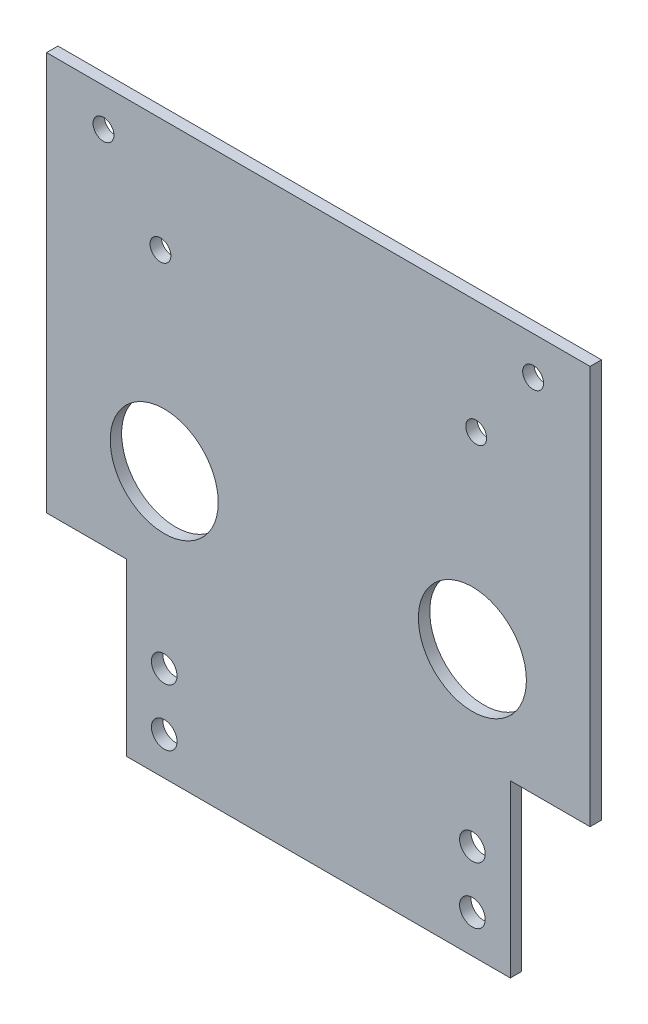
from build123d import *

# Parameters (mm, degrees)
SKETCH1_W           = 143.16
SKETCH1_H           = 150
BOSS_EXTRUDE1_DEPTH = 3
SKETCH2_R           = 14.225
SKETCH2_R_2         = 3.375
CUT_EXTRUDE1_DEPTH  = 208.373541225
SKETCH4_W           = 21
SKETCH4_H           = 45
CUT_EXTRUDE3_DEPTH  = 208.373541225
SKETCH5_R           = 2.75
CUT_EXTRUDE4_DEPTH  = 208.373541225


with BuildPart() as part:
    # Sketch1 → Boss-Extrude1 (new body)
    with BuildSketch(Plane.XY):
        with Locations((71.58, -75)):
            Rectangle(SKETCH1_W, SKETCH1_H)
    extrude(amount=BOSS_EXTRUDE1_DEPTH)

    # Sketch2 → Cut-Extrude1 (cut, through all)
    with BuildSketch(Plane.XY.offset(3)):
        with Locations((31, -80)):
            Circle(SKETCH2_R)
        with Locations((112.16, -80)):
            Circle(SKETCH2_R)
        with Locations((31, -140)):
            Circle(SKETCH2_R_2)
        with Locations((112.16, -140)):
            Circle(SKETCH2_R_2)
        with Locations((31, -125)):
            Circle(SKETCH2_R_2)
        with Locations((112.16, -125)):
            Circle(SKETCH2_R_2)
    extrude(amount=-CUT_EXTRUDE1_DEPTH, mode=Mode.SUBTRACT)

    # Sketch4 → Cut-Extrude3 (cut, through all)
    with BuildSketch(Plane.XY.offset(3)):
        with Locations((10.5, -127.5)):
            Rectangle(SKETCH4_W, SKETCH4_H)
        with Locations((132.66, -127.5)):
            Rectangle(SKETCH4_W, SKETCH4_H)
    extrude(amount=-CUT_EXTRUDE3_DEPTH, mode=Mode.SUBTRACT)

    # Sketch5 → Cut-Extrude4 (cut, through all)
    with BuildSketch(Plane.XY.offset(3)):
        with Locations((128.16, -10)):
            Circle(SKETCH5_R)
        with Locations((15, -10)):
            Circle(SKETCH5_R)
        with Locations((113.16, -30)):
            Circle(SKETCH5_R)
        with Locations((30, -30)):
            Circle(SKETCH5_R)
    extrude(amount=-CUT_EXTRUDE4_DEPTH, mode=Mode.SUBTRACT)


solid = part.part
